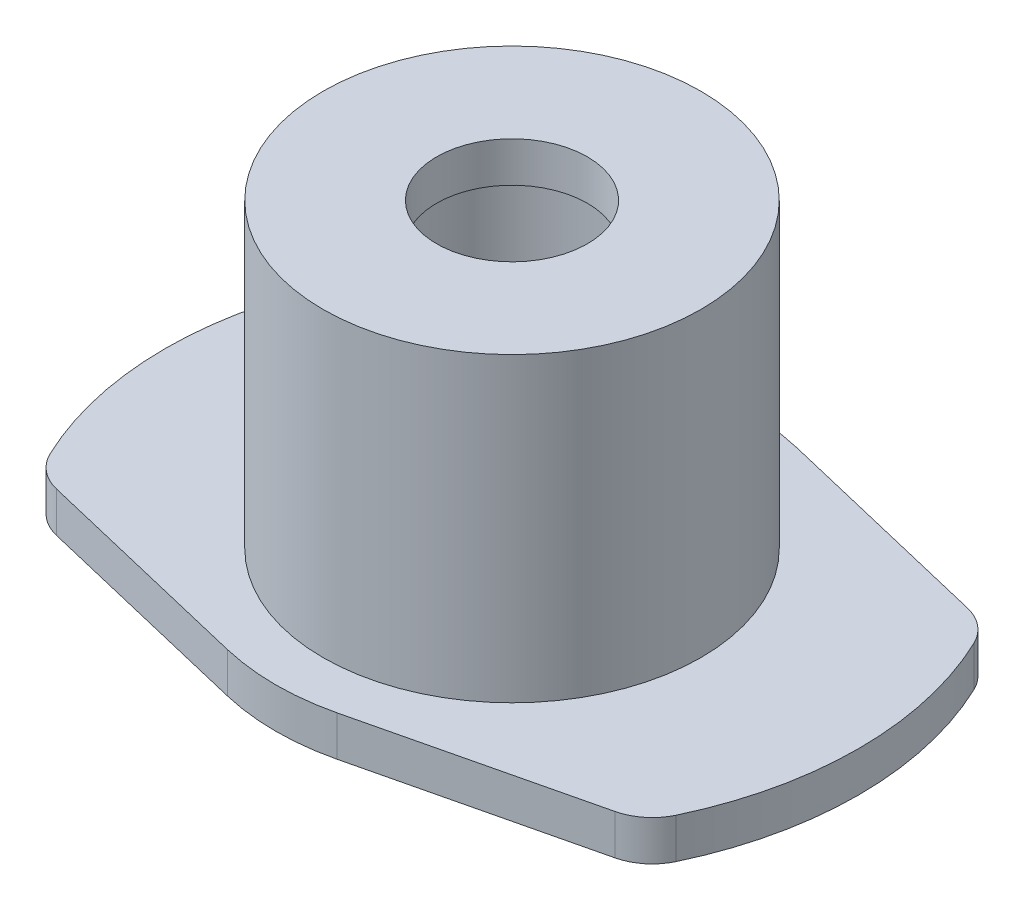
from build123d import *

# Parameters (mm, degrees)
BOSS_EXTRUDE1_DEPTH = 2
SKETCH2_R           = 9.4
BOSS_EXTRUDE2_DEPTH = 15
SKETCH3_R           = 5.1
CUT_EXTRUDE1_DEPTH  = 15
SKETCH4_R           = 3.75
CUT_EXTRUDE2_DEPTH  = 26.696546461
FILLET1_R           = 2.5


with BuildPart() as part:
    # Sketch1 → Boss-Extrude1 (new body)
    with BuildSketch(Plane(origin=(0, 0, 0), x_dir=(1, 0, 0), z_dir=(0, 1, 0))):
        with BuildLine():
            Line((-15, 8.5), (-2.727735344, 11.428996452))
            ThreePointArc((-2.727735344, 11.428996452), (0, 11.75), (2.727735344, 11.428996452))
            Line((2.727735344, 11.428996452), (15, 8.5))
            ThreePointArc((15, 8.5), (17.24093965, 0), (15, -8.5))
            Line((15, -8.5), (2.727735344, -11.428996452))
            ThreePointArc((2.727735344, -11.428996452), (0, -11.75), (-2.727735344, -11.428996452))
            Line((-2.727735344, -11.428996452), (-15, -8.5))
            ThreePointArc((-15, -8.5), (-17.24093965, 0), (-15, 8.5))
        make_face()
    extrude(amount=BOSS_EXTRUDE1_DEPTH)

    # Sketch2 → Boss-Extrude2 (add)
    with BuildSketch(Plane(origin=(0, 2, 0), x_dir=(1, 0, 0), z_dir=(0, 1, 0))):
        Circle(SKETCH2_R)
    extrude(amount=BOSS_EXTRUDE2_DEPTH)

    # Sketch3 → Cut-Extrude1 (cut)
    with BuildSketch(Plane.XZ):
        Circle(SKETCH3_R)
    extrude(amount=-CUT_EXTRUDE1_DEPTH, mode=Mode.SUBTRACT)

    # Sketch4 → Cut-Extrude2 (cut, through all)
    with BuildSketch(Plane.XZ.offset(-15)):
        Circle(SKETCH4_R)
    extrude(amount=-CUT_EXTRUDE2_DEPTH, mode=Mode.SUBTRACT)

    # Fillet1
    fillet1_edges = [part.edges().sort_by_distance(p)[0] for p in [
        (-15, 1, 8.5),
        (15, 1, -8.5),
        (15, 1, 8.5),
        (-15, 1, -8.5),
    ]]
    fillet(fillet1_edges, radius=FILLET1_R)


solid = part.part
